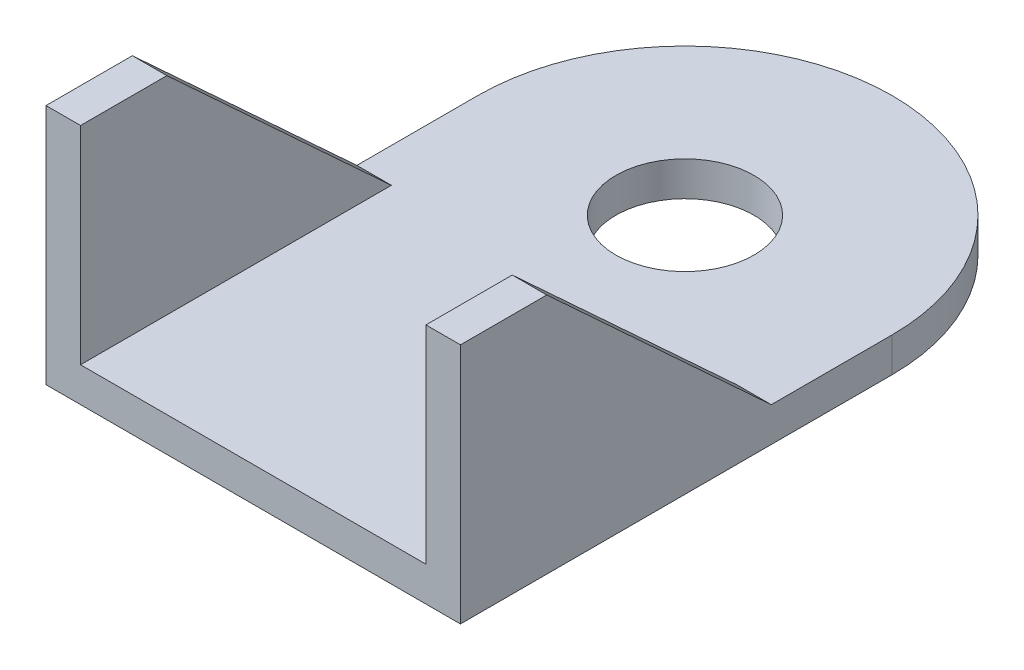
from build123d import *

# Parameters (mm, degrees)
SKETCH_1_R      = 4
EXTRUDE_1_DEPTH = 2
EXTRUDE_2_DEPTH = 2


with BuildPart() as part:
    # 草图1 → 凸台-拉伸1 (new body)
    with BuildSketch(Plane(origin=(0, 0, 0), x_dir=(1, 0, 0), z_dir=(0, 1, 0))):
        with BuildLine():
            Line((12, -25), (12, 0))
            ThreePointArc((12, 0), (0, 12), (-12, 0))
            Line((-12, 0), (-12, -25))
            Line((-12, -25), (12, -25))
        make_face()
        Circle(SKETCH_1_R, mode=Mode.SUBTRACT)
    extrude(amount=EXTRUDE_1_DEPTH)

    # 草图3 → 凸台-拉伸2 (add)
    with BuildSketch(Plane(origin=(12, 0, 0), x_dir=(0, 0, -1), z_dir=(1, 0, 0))):
        Polygon((-25, 2), (-25, 14), (-20, 14), (-7, 2), align=None)
    extrude_2 = extrude(amount=-EXTRUDE_2_DEPTH)

    # 镜向1: 凸台-拉伸2 across plane
    add(extrude_2.mirror(Plane(origin=(0, 0, 0), x_dir=(0, 0, 1), z_dir=(1, 0, 0))))


solid = part.part
